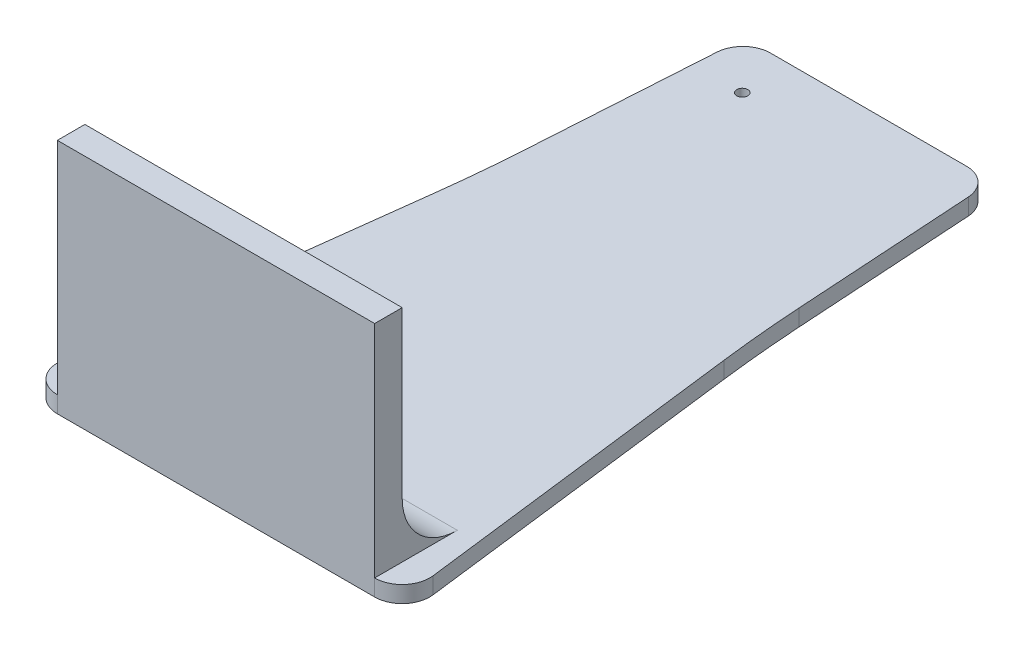
from build123d import *

# Parameters (mm, degrees)
BOSS_EXTRUDE1_DEPTH = 3
FILLET1_R           = 250
FILLET2_R           = 5
SKETCH2_R           = 1
CUT_EXTRUDE1_DEPTH  = 3
SKETCH3_W           = 57.60029736
SKETCH3_H           = 5
BOSS_EXTRUDE2_DEPTH = 40
FILLET3_R           = 10


with BuildPart() as part:
    # Sketch1 → Boss-Extrude1 (new body)
    with BuildSketch(Plane(origin=(0, 0, 0), x_dir=(1, 0, 0), z_dir=(0, 1, 0))):
        Polygon((-22.5, 52.5), (22.5, 52.5), (25.349290321, 7.5), (30, -30), (34.417386739, -65.618650519), (30, -65.950548022), (-30, -65.950548022), (-34.417386739, -65.618650519), (-30, -30), (-25.349290321, 7.5), align=None)
    extrude(amount=BOSS_EXTRUDE1_DEPTH)

    # Fillet1
    # the kernel refuses this fillet: 250 mm, written as the material it adds along each edge
    with BuildSketch(Plane(origin=(-25.349290321, 0, -7.5), x_dir=(-0.12307603906737652, 0, 0.9923972433493987), z_dir=(0, 1, 0))) as fillet1_piece_1:
        with BuildLine():
            CenterArc((FILLET1_R * 0.0300869468275, -FILLET1_R), FILLET1_R, 90, 3.446670391)
            Line((-FILLET1_R * 0.0300325252162, -FILLET1_R * 0.00180881135867), (0, 0))
            Line((0, 0), (FILLET1_R * 0.0300869468274, 0))
        make_face()
    extrude(amount=3)
    with BuildSketch(Plane(origin=(25.349290321, 0, -7.5), x_dir=(0.12307603906732778, 0, 0.9923972433494047), z_dir=(0, 1, 0))) as fillet1_piece_2:
        with BuildLine():
            CenterArc((FILLET1_R * 0.0300869468274, FILLET1_R), FILLET1_R, 266.553329609, 3.446670391)
            Line((-FILLET1_R * 0.0300325252162, FILLET1_R * 0.00180881135867), (0, 0))
            Line((0, 0), (FILLET1_R * 0.0300869468274, 0))
        make_face()
    extrude(amount=3)

    # Fillet2
    fillet2_edges = [part.edges().sort_by_distance(p)[0] for p in [
        (-22.5, 1.5, -52.5),
        (-34.417386739, 1.5, 65.618650519),
        (34.417386739, 1.5, 65.618650519),
        (22.5, 1.5, -52.5),
    ]]
    fillet(fillet2_edges, radius=FILLET2_R)

    # Sketch2 → Cut-Extrude1 (cut)
    with BuildSketch(Plane(origin=(0, 3, 0), x_dir=(1, 0, 0), z_dir=(0, 1, 0))):
        with Locations(Location((-14.115125166, 43.702233324, 0), (0, 0, 270))):
            Circle(SKETCH2_R)
    extrude(amount=-CUT_EXTRUDE1_DEPTH, mode=Mode.SUBTRACT)

    # Sketch3 → Boss-Extrude2 (add)
    with BuildSketch(Plane(origin=(0, 3, 0), x_dir=(1, 0, 0), z_dir=(0, 1, 0))):
        with Locations((0, -63.450548022)):
            Rectangle(SKETCH3_W, SKETCH3_H)
    extrude(amount=BOSS_EXTRUDE2_DEPTH)

    # Fillet3
    fillet3_edges = [part.edges().sort_by_distance(p)[0] for p in [
        (0, 3, 60.950548022),
    ]]
    fillet(fillet3_edges, radius=FILLET3_R)


solid = part.part
